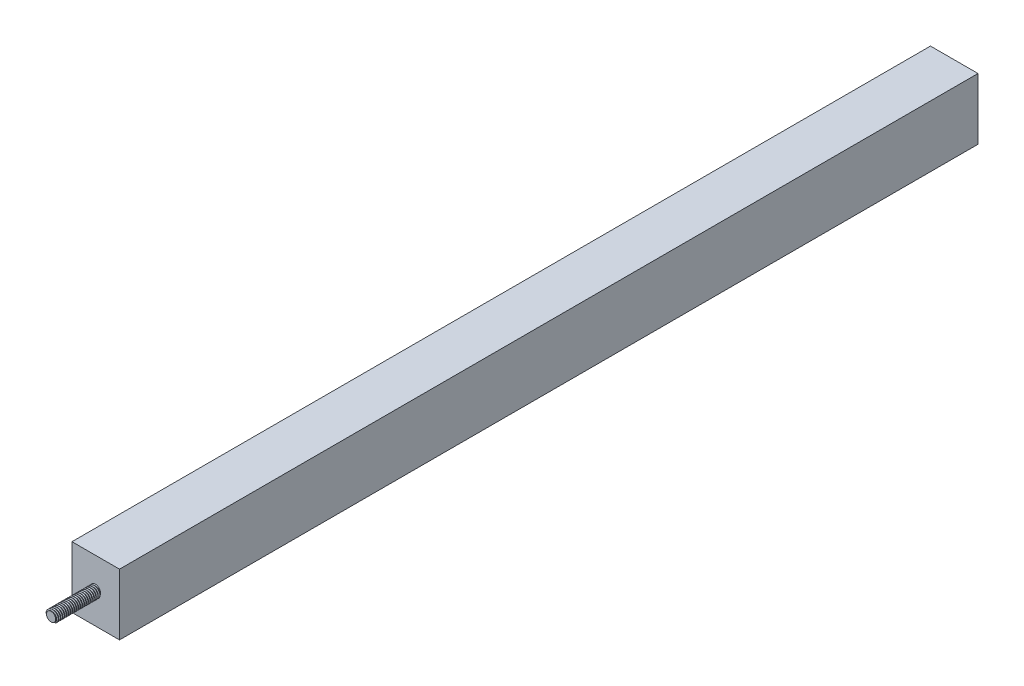
from build123d import *

# Parameters (mm, degrees)
SKETCH1_W           = 25.4
SKETCH1_H           = 32.766
BOSS_EXTRUDE1_DEPTH = 482.6
SKETCH2_W           = 25.4
SKETCH2_H           = 32.766
SKETCH2_R           = 2.45745
CUT_EXTRUDE2_DEPTH  = 23.876
THREAD2_PITCH       = 1.058333333


with BuildPart() as part:
    # Sketch1 → Boss-Extrude1 (new body)
    with BuildSketch(Plane.XY):
        with Locations((12.7, 16.383)):
            Rectangle(SKETCH1_W, SKETCH1_H)
    extrude(amount=-BOSS_EXTRUDE1_DEPTH)

    # Sketch2 → Cut-Extrude2 (cut)
    with BuildSketch(Plane.XY):
        with Locations((12.7, 16.383)):
            Rectangle(SKETCH2_W, SKETCH2_H)
        with Locations((12.7, 16.383)):
            Circle(SKETCH2_R, mode=Mode.SUBTRACT)
    extrude(amount=-CUT_EXTRUDE2_DEPTH, mode=Mode.SUBTRACT)

    # Thread2: the profile of Thread Profile2 profile screwed along a right-hand helix of 22.56 turns, 8 arcs to a turn; built about Z, then put on its axis
    thread2_z = Axis((0, 0, 0), (0, 0, 1))
    thread2_corners = [(2.45715, 0, -0.000173205), (3.030289718, 0, 0.330729165), (3.030289718, 0, 0.463020832), (2.45715, 0, 0.793923202)]
    with BuildLine(mode=Mode.PRIVATE) as thread2_profile:
        Line(thread2_corners[0], thread2_corners[1])
        Line(thread2_corners[1], thread2_corners[2])
        Line(thread2_corners[2], thread2_corners[3])
        Line(thread2_corners[3], thread2_corners[0])
    thread2_cap = Face(thread2_profile.wire())
    thread2_turn_angles = [0, 22.5, 45, 67.5, 90, 112.5, 135, 157.5, 180, 202.5, 225, 247.5, 270, 292.5, 315, 337.5, 360]
    thread2_turn_weights = [1, 0.9238795325112867, 1, 0.9238795325112867, 1, 0.9238795325112867, 1, 0.9238795325112867, 1, 0.9238795325112867, 1, 0.9238795325112867, 1, 0.9238795325112867, 1, 0.9238795325112867, 1]
    thread2_turn_rails = [Edge.make_bspline([Vector(p[0], p[1], 0).rotate(thread2_z, thread2_turn_angles[k]) / thread2_turn_weights[k] + Vector(0, 0, p[2] + THREAD2_PITCH * thread2_turn_angles[k] / 360) for k in range(17)], [0, 0, 0, 1, 1, 2, 2, 3, 3, 4, 4, 5, 5, 6, 6, 7, 7, 8, 8, 8], 2, thread2_turn_weights) for p in thread2_corners]
    thread2_turn_sides = [Face.make_surface_from_curves(thread2_turn_rails[p[0]], thread2_turn_rails[p[1]]) for p in [(0, 1), (1, 2), (2, 3), (3, 0)]]
    thread2_last_angles = [7920, 7942.5, 7965, 7987.5, 8010, 8032.5, 8055, 8077.5, 8100, 8110.8, 8121.6]
    thread2_last_weights = [1, 0.9238795325112867, 1, 0.9238795325112867, 1, 0.9238795325112867, 1, 0.9238795325112867, 1, 0.982287250728688, 1]
    thread2_last_rails = [Edge.make_bspline([Vector(p[0], p[1], 0).rotate(thread2_z, thread2_last_angles[k]) / thread2_last_weights[k] + Vector(0, 0, p[2] + THREAD2_PITCH * thread2_last_angles[k] / 360) for k in range(11)], [0, 0, 0, 1, 1, 2, 2, 3, 3, 4, 4, 5, 5, 5], 2, thread2_last_weights) for p in thread2_corners]
    thread2_last_sides = [Face.make_surface_from_curves(thread2_last_rails[p[0]], thread2_last_rails[p[1]]) for p in [(0, 1), (1, 2), (2, 3), (3, 0)]]
    thread2 = Plane(origin=(12.7, 16.383, 0), x_dir=(-1, 0, 0), z_dir=(0, 0, -1)) * Solid(Shell([*[p.moved(Location((0, 0, THREAD2_PITCH * i))) for i in range(22) for p in thread2_turn_sides], *thread2_last_sides, thread2_cap, thread2_cap.rotate(thread2_z, 8121.6).moved(Location((0, 0, THREAD2_PITCH * 8121.6 / 360)))]))
    add(thread2)


solid = part.part
